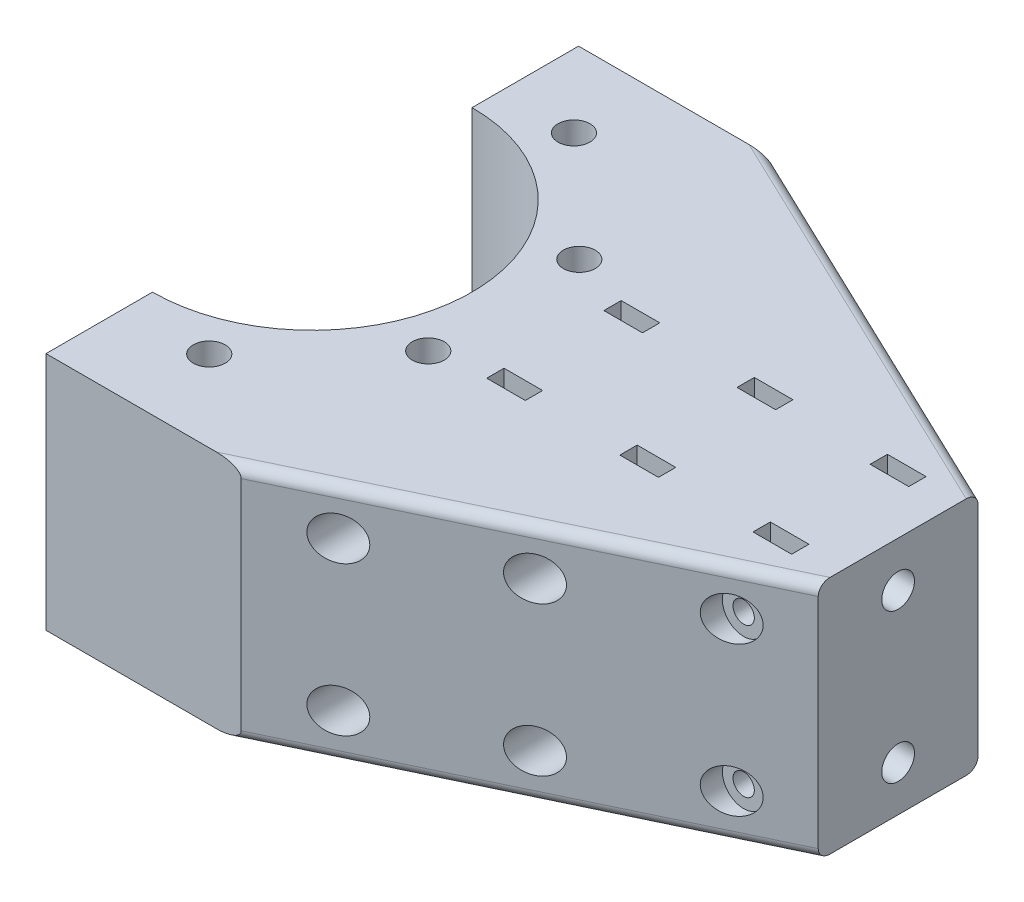
from build123d import *

# Parameters (mm, degrees)
SALIENTE_EXTRUIR1_DEPTH       = 45
CROQUIS2_R                    = 3.075
CORTAR_EXTRUIR1_DEPTH         = 129.937969582
CROQUIS3_R                    = 2
CORTAR_EXTRUIR2_DEPTH         = 129.937969702
CORTAR_EXTRUIR3_DEPTH         = 1.625
CORTAR_EXTRUIR4_START         = 18
CROQUIS6_R                    = 4
CORTAR_EXTRUIR4_DEPTH         = 111.937969702
CORTAR_EXTRUIR5_START         = 23
CROQUIS6_3_R                  = 4
CORTAR_EXTRUIR5_DEPTH         = 106.937969702
CORTAR_EXTRUIR6_START         = 33
CROQUIS6_4_R                  = 4
CORTAR_EXTRUIR6_DEPTH         = 96.937969702
SIMETR_A3_COPY_1_DEPTH        = 1.625
SIMETR_A3_START               = 18
SIMETR_A3_COPY_2_SKETCH_R     = 4
SIMETR_A3_COPY_2_DEPTH        = 111.937969702
SIMETR_A3_START_2             = 23
SIMETR_A3_COPY_3_SKETCH_R     = 4
SIMETR_A3_COPY_3_DEPTH        = 106.937969702
SIMETR_A3_START_3             = 33
SIMETR_A3_COPY_4_SKETCH_R     = 4
SIMETR_A3_COPY_4_DEPTH        = 96.937969702
REDONDEO1_R                   = 2
CROQUIS8_R                    = 3
CORTAR_EXTRUIR8_DEPTH         = 129.937969702
CORTAR_EXTRUIR10_REACH        = 138.938
CORTAR_EXTRUIR10_START_RADIUS = 30
CORTAR_EXTRUIR10_END_RADIUS   = 30
CROQUIS9_W                    = 8
CROQUIS9_H                    = 1
REDONDEO2_R                   = 1


with BuildPart() as part:
    # Croquis1 → Saliente-Extruir1 (new body)
    with BuildSketch(Plane(origin=(0, 0, 0), x_dir=(1, 0, 0), z_dir=(0, 1, 0))):
        with BuildLine():
            Line((0, 30), (0, 50))
            Line((0, 50), (36.66060556, 50))
            Line((36.66060556, 50), (110, 15))
            Line((110, 15), (110, -15))
            Line((110, -15), (36.66060556, -50))
            Line((36.66060556, -50), (0, -50))
            Line((0, -50), (0, -30))
            ThreePointArc((0, -30), (30, 0), (0, 30))
        make_face()
    extrude(amount=SALIENTE_EXTRUIR1_DEPTH)

    # Croquis2 → Cortar-Extruir1 (cut, through all)
    with BuildSketch(Plane(origin=(110, 0, 0), x_dir=(0, 0, -1), z_dir=(1, 0, 0))):
        with Locations((0, 36.5)):
            Circle(CROQUIS2_R)
        with Locations((0, 8.5)):
            Circle(CROQUIS2_R)
    extrude(amount=-CORTAR_EXTRUIR1_DEPTH, mode=Mode.SUBTRACT)

    # Croquis3 → Cortar-Extruir2 (cut, symmetric)
    with BuildSketch(Plane.XY):
        with Locations((74, 36.5)):
            Circle(CROQUIS3_R)
        with Locations((99, 36.5)):
            Circle(CROQUIS3_R)
        with Locations((49, 36.5)):
            Circle(CROQUIS3_R)
    cortar_extruir2 = extrude(amount=CORTAR_EXTRUIR2_DEPTH, both=True, mode=Mode.SUBTRACT)

    # Croquis5 → Cortar-Extruir3 (cut, symmetric)
    with BuildSketch(Plane.XY.offset(11)):
        Polygon((99, 32.314210548), (102.625, 34.407105274), (102.625, 45), (95.375, 45), (95.375, 34.407105274), align=None)
        Polygon((70.375, 45), (70.375, 34.407105274), (74, 32.314210548), (77.625, 34.407105274), (77.625, 45), align=None)
        Polygon((45.375, 45), (45.375, 34.407105274), (49, 32.314210548), (52.625, 34.407105274), (52.625, 45), align=None)
    cortar_extruir3 = extrude(amount=CORTAR_EXTRUIR3_DEPTH, both=True, mode=Mode.SUBTRACT)

    # Croquis6 → Cortar-Extruir4 (cut, through all)
    with BuildSketch(Plane.XY.offset(CORTAR_EXTRUIR4_START)):
        with Locations((99, 36.5)):
            Circle(CROQUIS6_R)
    cortar_extruir4 = extrude(amount=CORTAR_EXTRUIR4_DEPTH, mode=Mode.SUBTRACT)

    # Croquis6<3> → Cortar-Extruir5 (cut, through all)
    with BuildSketch(Plane.XY.offset(CORTAR_EXTRUIR5_START)):
        with Locations((74, 36.5)):
            Circle(CROQUIS6_3_R)
    cortar_extruir5 = extrude(amount=CORTAR_EXTRUIR5_DEPTH, mode=Mode.SUBTRACT)

    # Croquis6<4> → Cortar-Extruir6 (cut, through all)
    with BuildSketch(Plane.XY.offset(CORTAR_EXTRUIR6_START)):
        with Locations((49, 36.5)):
            Circle(CROQUIS6_4_R)
    cortar_extruir6 = extrude(amount=CORTAR_EXTRUIR6_DEPTH, mode=Mode.SUBTRACT)

    # Simetría2: Cortar-Extruir3, Cortar-Extruir4, Cortar-Extruir5, Cortar-Extruir6 across plane
    add(cortar_extruir3.mirror(Plane.XY), mode=Mode.SUBTRACT)
    add(cortar_extruir4.mirror(Plane.XY), mode=Mode.SUBTRACT)
    add(cortar_extruir5.mirror(Plane.XY), mode=Mode.SUBTRACT)
    add(cortar_extruir6.mirror(Plane.XY), mode=Mode.SUBTRACT)

    # Simetría3: Cortar-Extruir2, Cortar-Extruir3, Cortar-Extruir4, Cortar-Extruir5, Cortar-Extruir6 across plane
    add(cortar_extruir2.mirror(Plane(origin=(0, 22.5, 0), x_dir=(0, 0, 1), z_dir=(0, -1, 0))), mode=Mode.SUBTRACT)
    add(cortar_extruir3.mirror(Plane(origin=(0, 22.5, 0), x_dir=(0, 0, 1), z_dir=(0, -1, 0))), mode=Mode.SUBTRACT)
    add(cortar_extruir4.mirror(Plane(origin=(0, 22.5, 0), x_dir=(0, 0, 1), z_dir=(0, -1, 0))), mode=Mode.SUBTRACT)
    add(cortar_extruir5.mirror(Plane(origin=(0, 22.5, 0), x_dir=(0, 0, 1), z_dir=(0, -1, 0))), mode=Mode.SUBTRACT)
    add(cortar_extruir6.mirror(Plane(origin=(0, 22.5, 0), x_dir=(0, 0, 1), z_dir=(0, -1, 0))), mode=Mode.SUBTRACT)

    # Simetría3 copy 1 sketch → Simetría3 copy 1 (cut, symmetric)
    with BuildSketch(Plane(origin=(0, 45, -11), x_dir=(1, 0, 0), z_dir=(0, 0, -1))):
        Polygon((99, 32.314210548), (102.625, 34.407105274), (102.625, 45), (95.375, 45), (95.375, 34.407105274), align=None)
        Polygon((70.375, 45), (70.375, 34.407105274), (74, 32.314210548), (77.625, 34.407105274), (77.625, 45), align=None)
        Polygon((45.375, 45), (45.375, 34.407105274), (49, 32.314210548), (52.625, 34.407105274), (52.625, 45), align=None)
    extrude(amount=SIMETR_A3_COPY_1_DEPTH, both=True, mode=Mode.SUBTRACT)

    # Simetría3 copy 2 sketch → Simetría3 copy 2 (cut, through all)
    with BuildSketch(Plane(origin=(0, 45, 0), x_dir=(1, 0, 0), z_dir=(0, 0, -1)).offset(SIMETR_A3_START)):
        with Locations((99, 36.5)):
            Circle(SIMETR_A3_COPY_2_SKETCH_R)
    extrude(amount=SIMETR_A3_COPY_2_DEPTH, mode=Mode.SUBTRACT)

    # Simetría3 copy 3 sketch → Simetría3 copy 3 (cut, through all)
    with BuildSketch(Plane(origin=(0, 45, 0), x_dir=(1, 0, 0), z_dir=(0, 0, -1)).offset(SIMETR_A3_START_2)):
        with Locations((74, 36.5)):
            Circle(SIMETR_A3_COPY_3_SKETCH_R)
    extrude(amount=SIMETR_A3_COPY_3_DEPTH, mode=Mode.SUBTRACT)

    # Simetría3 copy 4 sketch → Simetría3 copy 4 (cut, through all)
    with BuildSketch(Plane(origin=(0, 45, 0), x_dir=(1, 0, 0), z_dir=(0, 0, -1)).offset(SIMETR_A3_START_3)):
        with Locations((49, 36.5)):
            Circle(SIMETR_A3_COPY_4_SKETCH_R)
    extrude(amount=SIMETR_A3_COPY_4_DEPTH, mode=Mode.SUBTRACT)

    # Redondeo1
    redondeo1_edges = [part.edges().sort_by_distance(p)[0] for p in [
        (73.33030278, 0, 32.5),
        (73.33030278, 45, 32.5),
        (73.33030278, 45, -32.5),
        (73.33030278, 0, -32.5),
    ]]
    fillet(redondeo1_edges, radius=REDONDEO1_R)

    # Croquis8 → Cortar-Extruir8 (cut, through all)
    with BuildSketch(Plane(origin=(0, 0, 0), x_dir=(1, 0, 0), z_dir=(0, 1, 0))):
        with Locations(Location((13.681034008, 35.451788509, 0), (0, 0, 90))):
            Circle(CROQUIS8_R)
        with Locations(Location((34.74215198, 15.394248139, 0), (0, 0, 90))):
            Circle(CROQUIS8_R)
        with Locations(Location((35.451788509, -13.681034008, 0), (0, 0, 90))):
            Circle(CROQUIS8_R)
        with Locations(Location((15.394248139, -34.74215198, 0), (0, 0, 90))):
            Circle(CROQUIS8_R)
    extrude(amount=CORTAR_EXTRUIR8_DEPTH, mode=Mode.SUBTRACT)

    # Cortar-Extruir10: from a cylinder face, 138.938 long prism both ways, kept between that surface and its translate by the depth
    cortar_extruir10_start = Plane(origin=(0, 0.5, 0), z_dir=(0, -1, 0)) * Cylinder(CORTAR_EXTRUIR10_START_RADIUS, 338.876, mode=Mode.PRIVATE)
    cortar_extruir10_end = Plane(origin=(8, 0.5, 0), z_dir=(0, -1, 0)) * Cylinder(CORTAR_EXTRUIR10_END_RADIUS, 338.876, mode=Mode.PRIVATE)
    # Croquis9 → Cortar-Extruir10 (cut, from a surface)
    with BuildSketch(Plane(origin=(0, 0, 0), x_dir=(0, 0, -1), z_dir=(1, 0, 0)), mode=Mode.PRIVATE) as cortar_extruir10_sk1:
        with Locations((0, 0.5)):
            Rectangle(CROQUIS9_W, CROQUIS9_H)
    cortar_extruir10_tool1 = extrude(cortar_extruir10_sk1.sketch, amount=CORTAR_EXTRUIR10_REACH, both=True, mode=Mode.PRIVATE)
    add(((cortar_extruir10_tool1 - cortar_extruir10_start) & cortar_extruir10_end).solids().sort_by_distance((33.732292, 0.5, 0))[0], mode=Mode.SUBTRACT)

    # Redondeo2
    redondeo2_edges = [part.edges().sort_by_distance(p)[0] for p in [
        (33.732137495, 1, 4),
        (33.732137495, 1, -4),
    ]]
    fillet(redondeo2_edges, radius=REDONDEO2_R - 0.0001)  # a hair under: the kernel refuses the full size


solid = part.part
